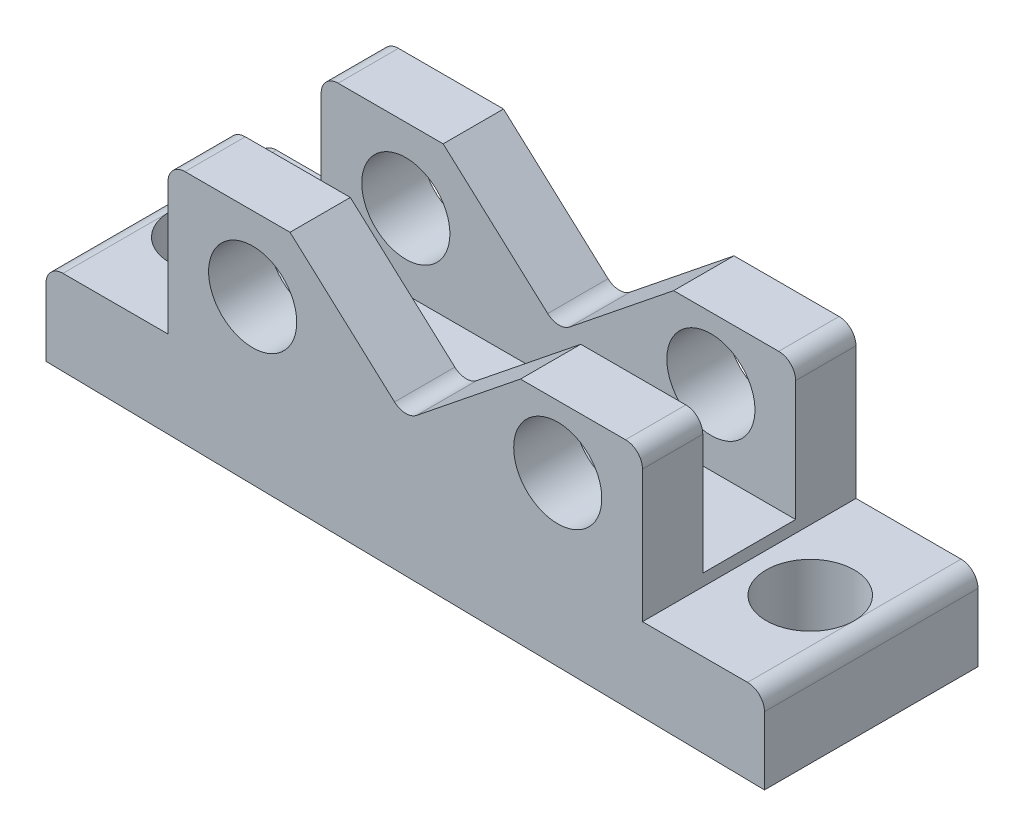
from build123d import *

# Parameters (mm, degrees)
BOSS_EXTRUDE1_DEPTH = 63
SKETCH10_R          = 13
CUT_EXTRUDE3_DEPTH  = 70
SKETCH12_R          = 13
CUT_EXTRUDE4_DEPTH  = 70
SKETCH16_W          = 140
SKETCH16_H          = 27.398314348
CUT_EXTRUDE6_DEPTH  = 44
SKETCH17_R          = 13
CUT_EXTRUDE7_DEPTH  = 100
FILLET1_R           = 5
FILLET2_R           = 5
FILLET3_R           = 5
FILLET4_R           = 5
FILLET5_R           = 5
FILLET6_R           = 5
FILLET7_R           = 5
FILLET8_R           = 5


with BuildPart() as part:
    # Sketch2 → Boss-Extrude1 (new body)
    with BuildSketch(Plane.XY):
        Polygon((0, 0), (212, -3.51679799), (212, 21.48320201), (176, 21.48320201), (176, 65.48320201), (140, 65.48320201), (106, 38.193220771), (72, 69), (36, 69), (36, 25), (0, 25), align=None)
    extrude(amount=BOSS_EXTRUDE1_DEPTH)

    # Sketch10 → Cut-Extrude3 (cut)
    with BuildSketch(Plane(origin=(0, 0, 0), x_dir=(-1, 0, 0), z_dir=(0, 0, -1))):
        with Locations((-150.998263924, 46.995976699)):
            Circle(SKETCH10_R)
    extrude(amount=-CUT_EXTRUDE3_DEPTH, mode=Mode.SUBTRACT)

    # Sketch12 → Cut-Extrude4 (cut)
    with BuildSketch(Plane(origin=(0, 25, 0), x_dir=(1, 0, 0), z_dir=(0, 1, 0))):
        with Locations(Location((18, -31.5, 0), (0, 0, 270))):
            Circle(SKETCH12_R)
        with Locations((194, -31.5)):
            Circle(SKETCH12_R)
    extrude(amount=-CUT_EXTRUDE4_DEPTH, mode=Mode.SUBTRACT)

    # Sketch16 → Cut-Extrude6 (cut)
    with BuildSketch(Plane(origin=(0, 69, 0), x_dir=(1, 0, 0), z_dir=(0, 1, 0))):
        with Locations((106, -31.506588427)):
            Rectangle(SKETCH16_W, SKETCH16_H)
    extrude(amount=-CUT_EXTRUDE6_DEPTH, mode=Mode.SUBTRACT)

    # Sketch17 → Cut-Extrude7 (cut)
    with BuildSketch(Plane.XY.offset(63)):
        with Locations((60.97435617, 46.978804013)):
            Circle(SKETCH17_R)
    extrude(amount=-CUT_EXTRUDE7_DEPTH, mode=Mode.SUBTRACT)

    # Fillet1
    fillet1_edges = [part.edges().sort_by_distance(p)[0] for p in [
        (106, 38.193220771, 8.903715627),
    ]]
    fillet(fillet1_edges, radius=FILLET1_R)

    # Fillet2
    fillet2_edges = [part.edges().sort_by_distance(p)[0] for p in [
        (106, 38.193220771, 54.102872801),
    ]]
    fillet(fillet2_edges, radius=FILLET2_R)

    # Fillet3
    fillet3_edges = [part.edges().sort_by_distance(p)[0] for p in [
        (212, 21.48320201, 31.5),
    ]]
    fillet(fillet3_edges, radius=FILLET3_R - 0.0001)  # a hair under: the kernel refuses the full size

    # Fillet4
    fillet4_edges = [part.edges().sort_by_distance(p)[0] for p in [
        (176, 65.48320201, 54.102872801),
    ]]
    fillet(fillet4_edges, radius=FILLET4_R)

    # Fillet5
    fillet5_edges = [part.edges().sort_by_distance(p)[0] for p in [
        (176, 65.48320201, 8.903715627),
    ]]
    fillet(fillet5_edges, radius=FILLET5_R)

    # Fillet6
    fillet6_edges = [part.edges().sort_by_distance(p)[0] for p in [
        (36, 69, 54.102872801),
    ]]
    fillet(fillet6_edges, radius=FILLET6_R)

    # Fillet7
    fillet7_edges = [part.edges().sort_by_distance(p)[0] for p in [
        (36, 69, 8.903715627),
    ]]
    fillet(fillet7_edges, radius=FILLET7_R)

    # Fillet8
    fillet8_edges = [part.edges().sort_by_distance(p)[0] for p in [
        (0, 25, 31.5),
    ]]
    fillet(fillet8_edges, radius=FILLET8_R - 0.0001)  # a hair under: the kernel refuses the full size


solid = part.part
